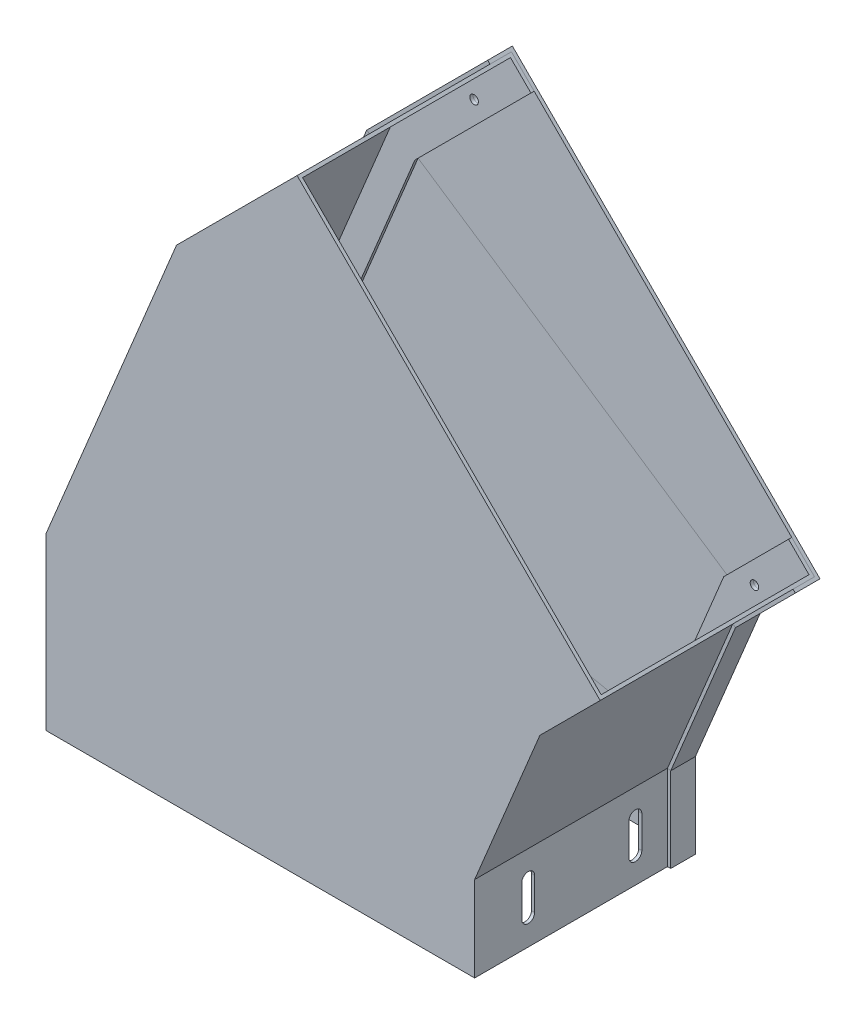
from build123d import *

# Parameters (mm, degrees)
CUT_EXTRUDE1_DEPTH      = 329.096306376
CUT_EXTRUDE1_DEPTH_BACK = 329.096306376
CUT_EXTRUDE2_DEPTH      = 288.740112802
CUT_EXTRUDE2_DEPTH_BACK = 288.740112802
SKETCH4_R               = 2
CUT_EXTRUDE3_DEPTH      = 493.44289009
CUT_EXTRUDE4_REACH      = 494.443
SKETCH5_R               = 2
SKETCH10_R              = 2
CUT_EXTRUDE5_DEPTH      = 495.424539237
SKETCH11_R              = 2
CUT_EXTRUDE6_DEPTH      = 495.424539237


with BuildPart() as part:
    # Sweep1: sweep along a path in ElbowArc
    with BuildLine(Plane.XY) as sweep1_path:
        Line((-300, 0), (-300, 59.673710214))
        Line((-300, 59.673710214), (-254.327719507, 169.936349205))
        Line((-254.327719507, 169.936349205), (-212.132034356, 212.132034356))
    # Sketch1 → Sweep1 (sweep)
    with BuildSketch(Plane(origin=(0, 0, 0), x_dir=(1, 0, 0), z_dir=(0, 1, 0))):
        Polygon((-200, -50), (-400, -50), (-400, 50), (-385, 50), (-385, 48.5), (-398.5, 48.5), (-398.5, -48.5), (-201.5, -48.5), (-201.5, 48.5), (-215, 48.5), (-215, 50), (-200, 50), align=None)
    sweep(path=sweep1_path.line, transition=Transition.RIGHT)

    # Sketch2 → Cut-Extrude1 (cut, two sides: drawn at the far end of the back side and taken through both)
    with BuildSketch(Plane(origin=(-300, 0, 0), x_dir=(0, 0, -1), z_dir=(1, 0, 0)).offset(-CUT_EXTRUDE1_DEPTH_BACK)):
        with BuildLine():
            Line((-28, 12.5), (-28, 27.5))
            ThreePointArc((-28, 27.5), (-25, 30.5), (-22, 27.5))
            Line((-22, 27.5), (-22, 12.5))
            ThreePointArc((-22, 12.5), (-25, 9.5), (-28, 12.5))
        make_face()
        with BuildLine():
            Line((22, 12.5), (22, 27.5))
            ThreePointArc((22, 27.5), (25, 30.5), (28, 27.5))
            Line((28, 27.5), (28, 12.5))
            ThreePointArc((28, 12.5), (25, 9.5), (22, 12.5))
        make_face()
    extrude(amount=CUT_EXTRUDE1_DEPTH + CUT_EXTRUDE1_DEPTH_BACK, mode=Mode.SUBTRACT)

    # Sketch3 → Cut-Extrude2 (cut, two sides: drawn at the far end of the back side and taken through both)
    with BuildSketch(Plane(origin=(-212.132034356, 212.132034356, 0), x_dir=(-0.7071067811865491, -0.7071067811865459, 0), z_dir=(-0.7071067811865459, 0.7071067811865491, 3.4914813388431334e-15)).offset(-CUT_EXTRUDE2_DEPTH_BACK)):
        with BuildLine():
            Line((12.5, 28), (27.5, 28))
            ThreePointArc((27.5, 28), (30.5, 25), (27.5, 22))
            Line((27.5, 22), (12.5, 22))
            ThreePointArc((12.5, 22), (9.5, 25), (12.5, 28))
        make_face()
        with BuildLine():
            Line((12.5, -22), (27.5, -22))
            ThreePointArc((27.5, -22), (30.5, -25), (27.5, -28))
            Line((27.5, -28), (12.5, -28))
            ThreePointArc((12.5, -28), (9.5, -25), (12.5, -22))
        make_face()
    extrude(amount=CUT_EXTRUDE2_DEPTH + CUT_EXTRUDE2_DEPTH_BACK, mode=Mode.SUBTRACT)

    # Sketch4 → Cut-Extrude3 (cut, through all)
    with BuildSketch(Plane(origin=(0, 0, 0), x_dir=(-1, 0, 0), z_dir=(0, 0, -1))):
        with Locations((392.5, 30)):
            Circle(SKETCH4_R)
        with Locations((207.5, 30)):
            Circle(SKETCH4_R)
    extrude(amount=CUT_EXTRUDE3_DEPTH, mode=Mode.SUBTRACT)

    # Sketch5 → Cut-Extrude4 (cut, up to next)
    with BuildSketch(Plane(origin=(0, 0, 0), x_dir=(0.7071067811865491, 0.7071067811865459, 0), z_dir=(0, 0, 1)), mode=Mode.PRIVATE) as cut_extrude4_sk1:
        with Locations((-30, 392.5)):
            Circle(SKETCH5_R)
    cut_extrude4_tool1 = extrude(cut_extrude4_sk1.sketch, amount=-CUT_EXTRUDE4_REACH, mode=Mode.PRIVATE) & part.part
    # Sketch5 → Cut-Extrude4 (cut, up to next)
    with BuildSketch(Plane(origin=(0, 0, 0), x_dir=(0.7071067811865491, 0.7071067811865459, 0), z_dir=(0, 0, 1)), mode=Mode.PRIVATE) as cut_extrude4_sk2:
        with Locations((-30, 207.5)):
            Circle(SKETCH5_R)
    cut_extrude4_tool2 = extrude(cut_extrude4_sk2.sketch, amount=-CUT_EXTRUDE4_REACH, mode=Mode.PRIVATE) & part.part
    add(cut_extrude4_tool1.solids().sort_by_distance((-298.752615, 256.326208, 0))[0], mode=Mode.SUBTRACT)
    add(cut_extrude4_tool2.solids().sort_by_distance((-167.937861, 125.511454, 0))[0], mode=Mode.SUBTRACT)


with BuildPart() as body_2:
    # Sweep2: sweep along a path in ElbowArc<2>
    with BuildLine(Plane.XY) as sweep2_path:
        Line((-300, 0), (-300, 59.673710214))
        Line((-300, 59.673710214), (-254.327719507, 169.936349205))
        Line((-254.327719507, 169.936349205), (-212.132034356, 212.132034356))
    # Sketch8 → Sweep2 (sweep)
    with BuildSketch(Plane(origin=(0, 0, 0), x_dir=(1, 0, 0), z_dir=(0, 1, 0))):
        Polygon((-400, 40), (-400, 50), (-200, 50), (-200, 40), (-198.5, 40), (-198.5, 51.5), (-401.5, 51.5), (-401.5, 40), align=None)
    sweep(path=sweep2_path.line, transition=Transition.RIGHT)

    # Sketch10 → Cut-Extrude5 (cut, through all)
    with BuildSketch(Plane(origin=(0, 0, 0), x_dir=(0, 1, 0), z_dir=(0, 0, 1))):
        with Locations((30, 207.5)):
            Circle(SKETCH10_R)
        with Locations((30, 392.5)):
            Circle(SKETCH10_R)
    extrude(amount=-CUT_EXTRUDE5_DEPTH, mode=Mode.SUBTRACT)

    # Sketch11 → Cut-Extrude6 (cut, through all)
    with BuildSketch(Plane(origin=(0, 0, 0), x_dir=(0.7071067811865491, 0.7071067811865459, 0), z_dir=(0, 0, 1))):
        with Locations((-30, 207.5)):
            Circle(SKETCH11_R)
        with Locations((-30, 392.5)):
            Circle(SKETCH11_R)
    extrude(amount=-CUT_EXTRUDE6_DEPTH, mode=Mode.SUBTRACT)


solid = Compound([part.part, body_2.part])
